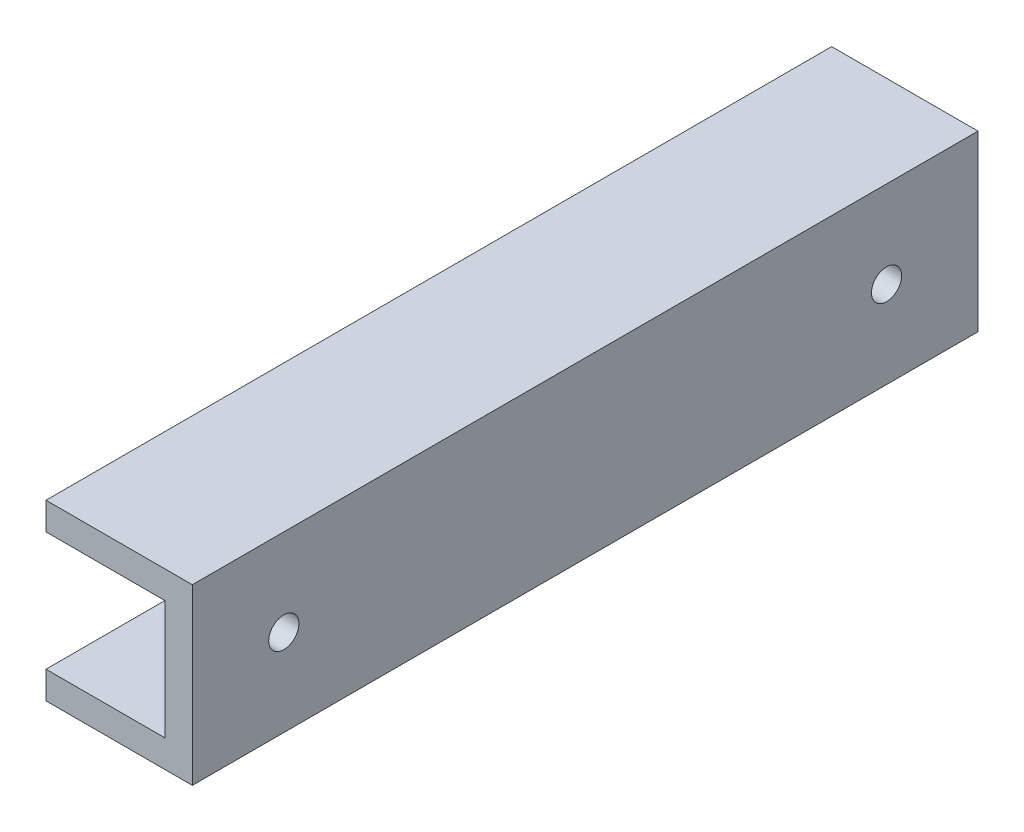
from build123d import *

# Parameters (mm, degrees)
SKETCH_1_W          = 19
SKETCH_1_H          = 19
SKETCH_1_W_2        = 13
SKETCH_1_H_2        = 13
EXTRUDE_1_DEPTH     = 85.9
SKETCH_2_R          = 1.65
CUT_EXTRUDE_1_DEPTH = 30
SKETCH_3_W          = 116.915177823
SKETCH_3_H          = 46.219516436
CUT_EXTRUDE_2_DEPTH = 3
SKETCH_4_W          = 5
SKETCH_4_H          = 13
EXTRUDE_1_2_DEPTH   = 10
SKETCH_5_W          = 29.9
SKETCH_5_H          = 5
EXTRUDE_2_DEPTH     = 10
SKETCH_6_W          = 39.9
SKETCH_6_H          = 13
EXTRUDE_3_DEPTH     = 10
SKETCH_8_W          = 39.9
SKETCH_8_H          = 5
CUT_EXTRUDE_3_DEPTH = 3
CHAMFER_1_SIZE      = 3
CHAMFER_2_SIZE      = 4


with BuildPart() as part:
    # 草图1 → Extrude 1 (new body)
    with BuildSketch(Plane.XY):
        with Locations((6.5, 6.5)):
            Rectangle(SKETCH_1_W, SKETCH_1_H)
        with Locations((6.5, 6.5)):
            Rectangle(SKETCH_1_W_2, SKETCH_1_H_2, mode=Mode.SUBTRACT)
    extrude(amount=EXTRUDE_1_DEPTH)

    # 草图2 → 切除-拉伸1 (cut)
    with BuildSketch(Plane.ZY.offset(3)):
        with Locations((10, 6.5)):
            Circle(SKETCH_2_R)
        with Locations((75.9, 6.5)):
            Circle(SKETCH_2_R)
    extrude(amount=-CUT_EXTRUDE_1_DEPTH, mode=Mode.SUBTRACT)

    # 草图3 → 切除-拉伸2 (cut)
    with BuildSketch(Plane.ZY.offset(3)):
        with Locations((53.162237228, 0.202739406)):
            Rectangle(SKETCH_3_W, SKETCH_3_H)
    extrude(amount=-CUT_EXTRUDE_2_DEPTH, mode=Mode.SUBTRACT)

    # 草图4 → Extrude 1 2 (add)
    with BuildSketch(Plane.ZY.offset(-13)):
        with Locations((25.5, 6.5)):
            Rectangle(SKETCH_4_W, SKETCH_4_H)
        with Locations((60.4, 6.5)):
            Rectangle(SKETCH_4_W, SKETCH_4_H)
    extrude(amount=EXTRUDE_1_2_DEPTH)

    # 草图5 → 凸台-拉伸2 (add)
    with BuildSketch(Plane.ZY.offset(-13)):
        with Locations((42.95, 6.5)):
            Rectangle(SKETCH_5_W, SKETCH_5_H)
    extrude(amount=EXTRUDE_2_DEPTH)

    # 草图6 → 凸台-拉伸3 (add)
    with BuildSketch(Plane.ZY.offset(-13)):
        with Locations((42.95, 6.5)):
            Rectangle(SKETCH_6_W, SKETCH_6_H)
    extrude(amount=EXTRUDE_3_DEPTH)

    # 草图8 → 切除-拉伸3 (cut)
    with BuildSketch(Plane.ZY.offset(-3)):
        with Locations((42.95, 6.5)):
            Rectangle(SKETCH_8_W, SKETCH_8_H)
    extrude(amount=-CUT_EXTRUDE_3_DEPTH, mode=Mode.SUBTRACT)

    # 倒角1
    chamfer_1_edges = [part.edges().sort_by_distance(p)[0] for p in [
        (6, 6.5, 23),
        (6, 6.5, 62.9),
    ]]
    chamfer(chamfer_1_edges, length=CHAMFER_1_SIZE)

    # 倒角2
    chamfer_2_edges = [part.edges().sort_by_distance(p)[0] for p in [
        (13, 6.5, 23),
        (13, 6.5, 62.9),
    ]]
    chamfer(chamfer_2_edges, length=CHAMFER_2_SIZE - 0.0001)  # a hair under: the kernel refuses the full size


solid = part.part
